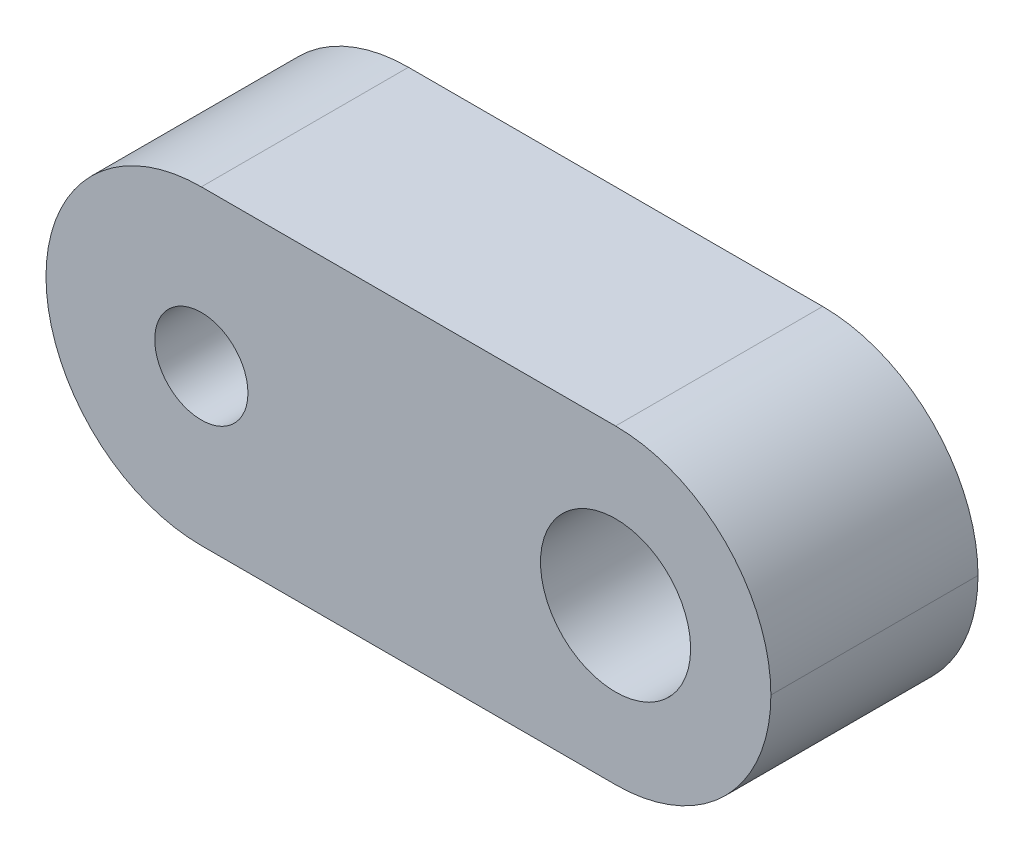
from build123d import *

# Parameters (mm, degrees)
SKETCH1_W               = 14
SKETCH1_H               = 6
BOSS_EXTRUDE1_DEPTH     = 4
CUT_EXTRUDE1_DEPTH      = 16.748015748
CUT_EXTRUDE1_DEPTH_BACK = 16.748015748
SKETCH2_R               = 0.9
SKETCH2_R_2             = 1.45
FILLET1_R               = 3


with BuildPart() as part:
    # Sketch1 → Boss-Extrude1 (new body)
    with BuildSketch(Plane.XY):
        with Locations((7, -3)):
            Rectangle(SKETCH1_W, SKETCH1_H)
    extrude(amount=BOSS_EXTRUDE1_DEPTH)

    # Sketch2 → Cut-Extrude1 (cut, two sides: drawn at the far end of the back side and taken through both)
    with BuildSketch(Plane.XY.offset(4).offset(-CUT_EXTRUDE1_DEPTH_BACK)):
        with Locations((3, -3)):
            Circle(SKETCH2_R)
        with Locations((11, -3)):
            Circle(SKETCH2_R_2)
    extrude(amount=CUT_EXTRUDE1_DEPTH + CUT_EXTRUDE1_DEPTH_BACK, mode=Mode.SUBTRACT)

    # Fillet1
    fillet1_edges = [part.edges().sort_by_distance(p)[0] for p in [
        (14, -6, 2),
        (14, 0, 2),
        (0, -6, 2),
        (0, 0, 2),
    ]]
    fillet(fillet1_edges, radius=FILLET1_R - 0.0001)  # a hair under: the kernel refuses the full size


solid = part.part
